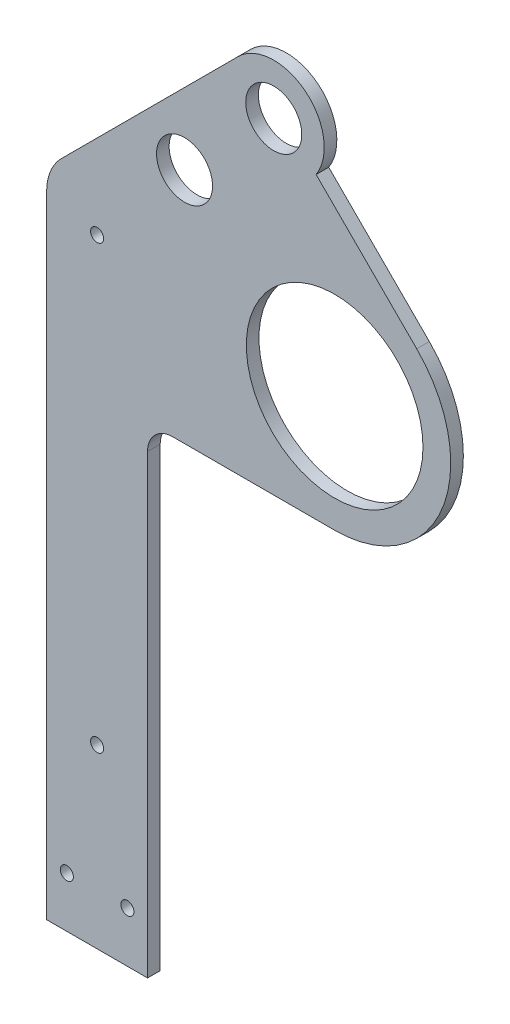
from build123d import *

# Parameters (mm, degrees)
SKETCH_1_R                = 20
SKETCH_1_R_2              = 11.1
EXTRUDE_1_DEPTH           = 60
EXTRUDE_2_DEPTH           = 30
SKETCH_4_R                = 11
EXTRUDE_3_DEPTH           = 5
SKETCH_8_R                = 11.1
CUT_EXTRUDE_1_DEPTH       = 100
FILLET_4_R                = 20
EXTRUDE_START             = -30
SKETCH_18_R               = 35
EXTRUDE_4_DEPTH           = 5
EXTRUDE_START_2           = -25
SKETCH_19_R               = 35
EXTRUDE_5_DEPTH           = 5
FILLET_5_R                = 10
CUT_EXTRUDE_9_DEPTH       = 388.169213652
CUT_EXTRUDE_9_DEPTH_BACK  = 388.169213652
SKETCH_21_R               = 2.6
CUT_EXTRUDE_10_DEPTH      = 409.372938359
CUT_EXTRUDE_10_DEPTH_BACK = 409.372938359
SKETCH_22_W               = 35
SKETCH_22_H               = 453.381241258
SKETCH_22_W_2             = 30
SKETCH_22_H_2             = 431.087956996


with BuildPart() as part:
    # 草图1 → 凸台-拉伸1 (new body)
    with BuildSketch(Plane.XY):
        Circle(SKETCH_1_R)
        Circle(SKETCH_1_R_2, mode=Mode.SUBTRACT)
    extrude(amount=EXTRUDE_1_DEPTH)

    # 草图2 → 凸台-拉伸2 (add, symmetric)
    with BuildSketch(Plane.XY.offset(30)):
        with BuildLine():
            Line((-14.142135624, 14.142135624), (-90, -61.715728753))
            Line((-90, -61.715728753), (-90, -320))
            Line((-90, -320), (-50, -320))
            Line((-50, -320), (-50, -78.284271247))
            Line((-50, -78.284271247), (14.142135624, -14.142135624))
            ThreePointArc((14.142135624, -14.142135624), (-14.142135624, -14.142135624), (-14.142135624, 14.142135624))
        make_face()
    extrude(amount=EXTRUDE_2_DEPTH, both=True)

    # 草图4 → 凸台-拉伸3 (add)
    with BuildSketch(Plane.XY.offset(60)):
        with BuildLine():
            Line((-90, -290), (-50, -290))
            Line((-50, -290), (-50, -350))
            ThreePointArc((-50, -350), (-70, -370), (-90, -350))
            Line((-90, -350), (-90, -290))
        make_face()
        with Locations((-70, -350)):
            Circle(SKETCH_4_R, mode=Mode.SUBTRACT)
    extrude_3 = extrude(amount=EXTRUDE_3_DEPTH)

    # 镜向1: 凸台-拉伸3 across plane
    add(extrude_3.mirror(Plane.XY.offset(30)))

    # 草图8 → 切除-拉伸1 (cut)
    with BuildSketch(Plane.XY.offset(60)):
        with Locations((-35.355339059, -35.355339059)):
            Circle(SKETCH_8_R)
    extrude(amount=-CUT_EXTRUDE_1_DEPTH, mode=Mode.SUBTRACT)

    # 圆角4
    fillet_4_edges = [part.edges().sort_by_distance(p)[0] for p in [
        (-50, -78.284271247, 30),
        (-90, -61.715728753, 30),
    ]]
    fillet(fillet_4_edges, radius=FILLET_4_R)

    # 草图18 → 凸台-拉伸4 (add)
    with BuildSketch(Plane.XY.offset(60).offset(EXTRUDE_START)):
        with BuildLine():
            ThreePointArc((16.783988507, -10.876475983), (15.54903282, -12.578854413), (14.142135624, -14.142135624))
            Line((14.142135624, -14.142135624), (-44.142135624, -72.426406871))
            ThreePointArc((-44.142135624, -72.426406871), (-48.47759065, -78.914873848), (-50, -86.568542495))
            Line((-50, -86.568542495), (-50, -129.282056212))
            Line((-50, -129.282056212), (24.135744866, -129.282056212))
            ThreePointArc((24.135744866, -129.282056212), (66.634203362, -100.885494101), (56.662656801, -50.755144277))
            Line((56.662656801, -50.755144277), (16.783988507, -10.876475983))
        make_face()
        with Locations((24.135744866, -83.282056212)):
            Circle(SKETCH_18_R, mode=Mode.SUBTRACT)
    extrude(amount=EXTRUDE_4_DEPTH)

    # 草图19 → 凸台-拉伸5 (add)
    with BuildSketch(Plane(origin=(0, 0, 0), x_dir=(-1, 0, 0), z_dir=(0, 0, -1)).offset(EXTRUDE_START_2)):
        with BuildLine():
            Line((50, -135.340123781), (50, -227.340123781))
            Line((50, -227.340123781), (-4.524131353, -227.340123781))
            ThreePointArc((-4.524131353, -227.340123781), (-50.524131353, -181.340123781), (-4.524131353, -135.340123781))
            Line((-4.524131353, -135.340123781), (50, -135.340123781))
        make_face()
        with Locations((-4.524131353, -181.340123781)):
            Circle(SKETCH_19_R, mode=Mode.SUBTRACT)
    extrude(amount=-EXTRUDE_5_DEPTH)

    # 圆角5
    # the kernel refuses this fillet: 10 mm, written as the material it adds along each edge
    with BuildSketch(Plane(origin=(-50, -227.340123781, 25), x_dir=(0, -1, 0), z_dir=(0, 0, 1)), Plane(origin=(-50, -129.282056212, 30), x_dir=(0, -1, 0), z_dir=(0, 0, 1))) as fillet_5_piece_1:
        with BuildLine():
            CenterArc((FILLET_5_R, FILLET_5_R), FILLET_5_R, 180, 90)
            Line((0, FILLET_5_R), (0, 0))
            Line((0, 0), (FILLET_5_R, 0))
        make_face()
    extrude(amount=5)

    # 草图21 → 切除-拉伸9 (cut, two sides: drawn at the far end of the back side and taken through both)
    with BuildSketch(Plane.XY.offset(65).offset(-CUT_EXTRUDE_9_DEPTH_BACK)):
        with Locations((-70, -75)):
            Circle(SKETCH_21_R)
        with Locations((-70, -250)):
            Circle(SKETCH_21_R)
        with Locations((-58, -300)):
            Circle(SKETCH_21_R)
        with Locations((-82, -300)):
            Circle(SKETCH_21_R)
    extrude(amount=CUT_EXTRUDE_9_DEPTH + CUT_EXTRUDE_9_DEPTH_BACK, mode=Mode.SUBTRACT)

    # 草图22 → 切除-拉伸10 (cut, two sides: drawn at the far end of the back side and taken through both)
    with BuildSketch(Plane.ZY.offset(90).offset(-CUT_EXTRUDE_10_DEPTH_BACK)):
        with Locations((12.5, -161.772701044)):
            Rectangle(SKETCH_22_W, SKETCH_22_H)
        with Locations((50, -154.456021502)):
            Rectangle(SKETCH_22_W_2, SKETCH_22_H_2)
    extrude(amount=CUT_EXTRUDE_10_DEPTH + CUT_EXTRUDE_10_DEPTH_BACK, mode=Mode.SUBTRACT)


solid = part.part
